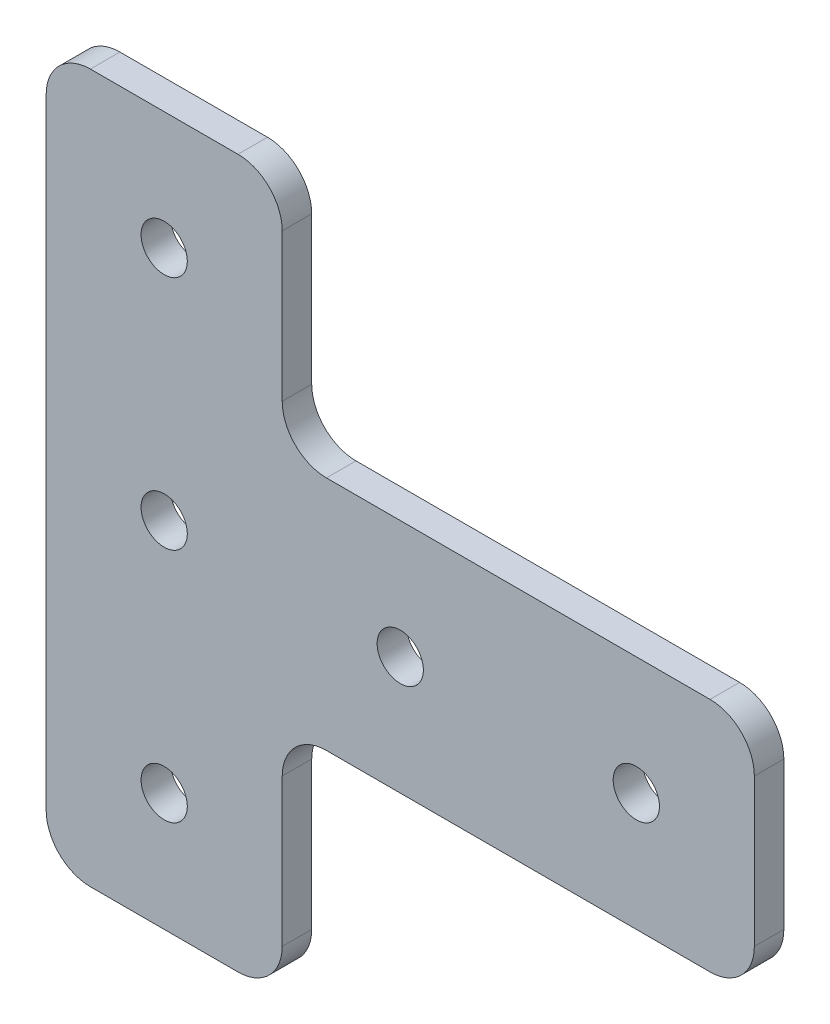
from build123d import *

# Parameters (mm, degrees)
SKETCH1_R           = 2.4892
BOSS_EXTRUDE1_DEPTH = 1.5875
FILLET1_R           = 4.7625


with BuildPart() as part:
    # Sketch1 → Boss-Extrude1 (new, symmetric)
    with BuildSketch(Plane.XY):
        Polygon((0, 0), (0, 76.2), (25.4, 76.2), (25.4, 50.8), (76.2, 50.8), (76.2, 25.4), (25.4, 25.4), (25.4, 0), align=None)
        with Locations((12.7, 63.5)):
            Circle(SKETCH1_R, mode=Mode.SUBTRACT)
        with Locations((12.7, 38.1)):
            Circle(SKETCH1_R, mode=Mode.SUBTRACT)
        with Locations((12.7, 12.7)):
            Circle(SKETCH1_R, mode=Mode.SUBTRACT)
        with Locations((38.1, 38.1)):
            Circle(SKETCH1_R, mode=Mode.SUBTRACT)
        with Locations((63.5, 38.1)):
            Circle(SKETCH1_R, mode=Mode.SUBTRACT)
    extrude(amount=BOSS_EXTRUDE1_DEPTH, both=True)

    # Fillet1
    fillet1_edges = [part.edges().sort_by_distance(p)[0] for p in [
        (0, 0, 0),
        (0, 76.2, 0),
        (76.2, 50.8, 0),
        (76.2, 25.4, 0),
        (25.4, 25.4, 0),
        (25.4, 0, 0),
        (25.4, 50.8, 0),
        (25.4, 76.2, 0),
    ]]
    fillet(fillet1_edges, radius=FILLET1_R)


solid = part.part
